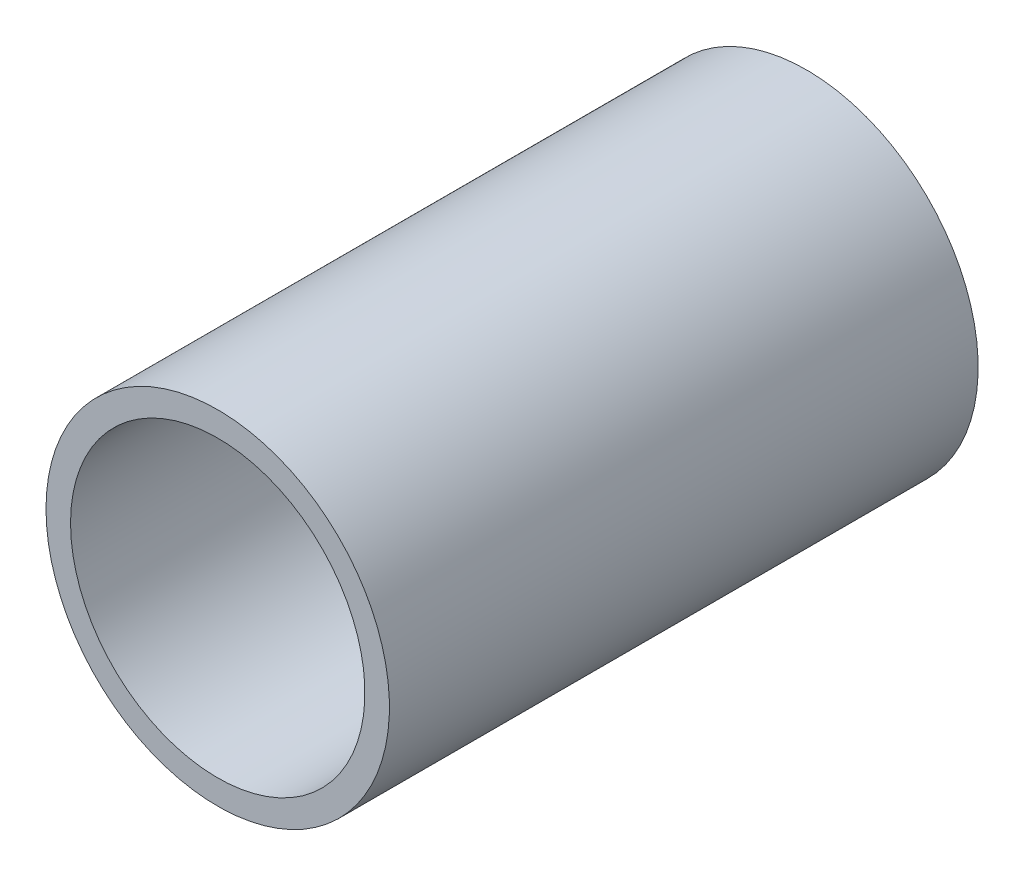
from build123d import *

# Parameters (mm, degrees)
SKETCH1_R           = 22.225
SKETCH1_R_2         = 19.05
BOSS_EXTRUDE1_DEPTH = 76.2


with BuildPart() as part:
    # Sketch1 → Boss-Extrude1 (new body)
    with BuildSketch(Plane.XY):
        Circle(SKETCH1_R)
        Circle(SKETCH1_R_2, mode=Mode.SUBTRACT)
    extrude(amount=BOSS_EXTRUDE1_DEPTH)


solid = part.part
